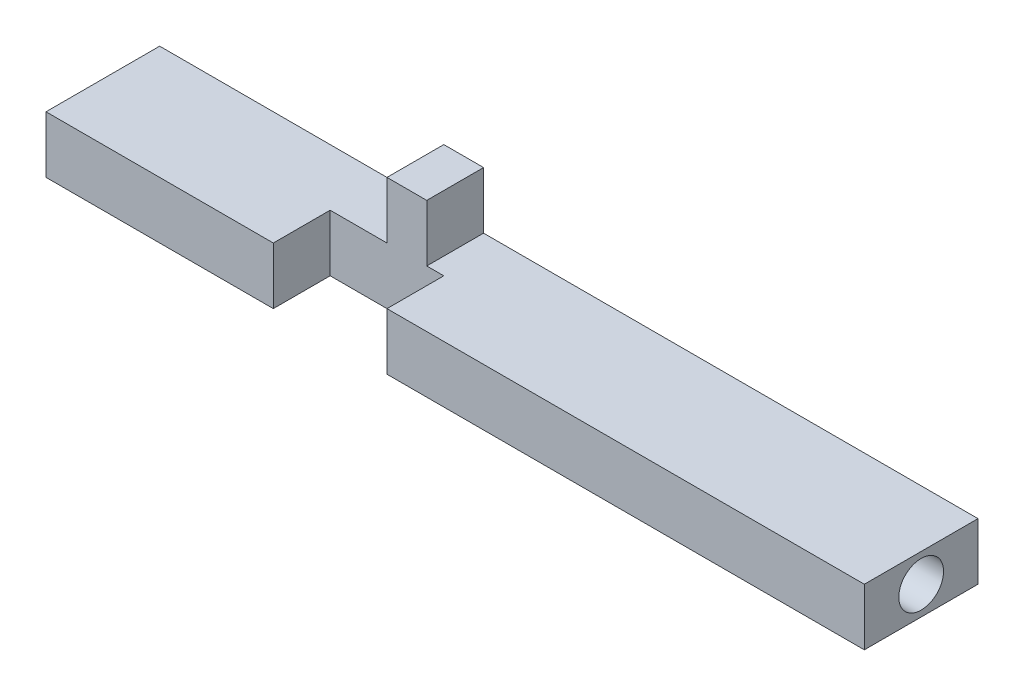
from build123d import *

# Parameters (mm, degrees)
SKETCH1_W           = 45.72
SKETCH1_H           = 6.35
BOSS_EXTRUDE1_DEPTH = 1.5875
SKETCH4_W           = 6.35
SKETCH4_H           = 3.175
CUT_EXTRUDE1_DEPTH  = 3.175
SKETCH5_W           = 2.2225
SKETCH5_H           = 3.175
BOSS_EXTRUDE3_DEPTH = 3.175
SKETCH3_R           = 1.25
CUT_EXTRUDE2_DEPTH  = 6.985


with BuildPart() as part:
    # Sketch1 → Boss-Extrude1 (new, symmetric)
    with BuildSketch(Plane(origin=(0, 0, 0), x_dir=(1, 0, 0), z_dir=(0, 1, 0))):
        Rectangle(SKETCH1_W, SKETCH1_H)
    extrude(amount=BOSS_EXTRUDE1_DEPTH, both=True)

    # Sketch4 → Cut-Extrude1 (cut)
    with BuildSketch(Plane.XY.offset(3.175)):
        with Locations((-6.985, 0)):
            Rectangle(SKETCH4_W, SKETCH4_H)
    extrude(amount=-CUT_EXTRUDE1_DEPTH, mode=Mode.SUBTRACT)

    # Sketch5 → Boss-Extrude3 (add)
    with BuildSketch(Plane(origin=(0, 1.5875, 0), x_dir=(1, 0, 0), z_dir=(0, 1, 0))):
        with Locations((-5.87375, 1.5875)):
            Rectangle(SKETCH5_W, SKETCH5_H)
    extrude(amount=BOSS_EXTRUDE3_DEPTH)

    # Sketch3 → Cut-Extrude2 (cut)
    with BuildSketch(Plane.ZY.offset(22.86)):
        Circle(SKETCH3_R)
    cut_extrude2 = extrude(amount=-CUT_EXTRUDE2_DEPTH, mode=Mode.SUBTRACT)

    # Mirror1: Cut-Extrude2 across plane
    add(cut_extrude2.mirror(Plane(origin=(0, 0, 0), x_dir=(0, 0, 1), z_dir=(1, 0, 0))), mode=Mode.SUBTRACT)


solid = part.part
